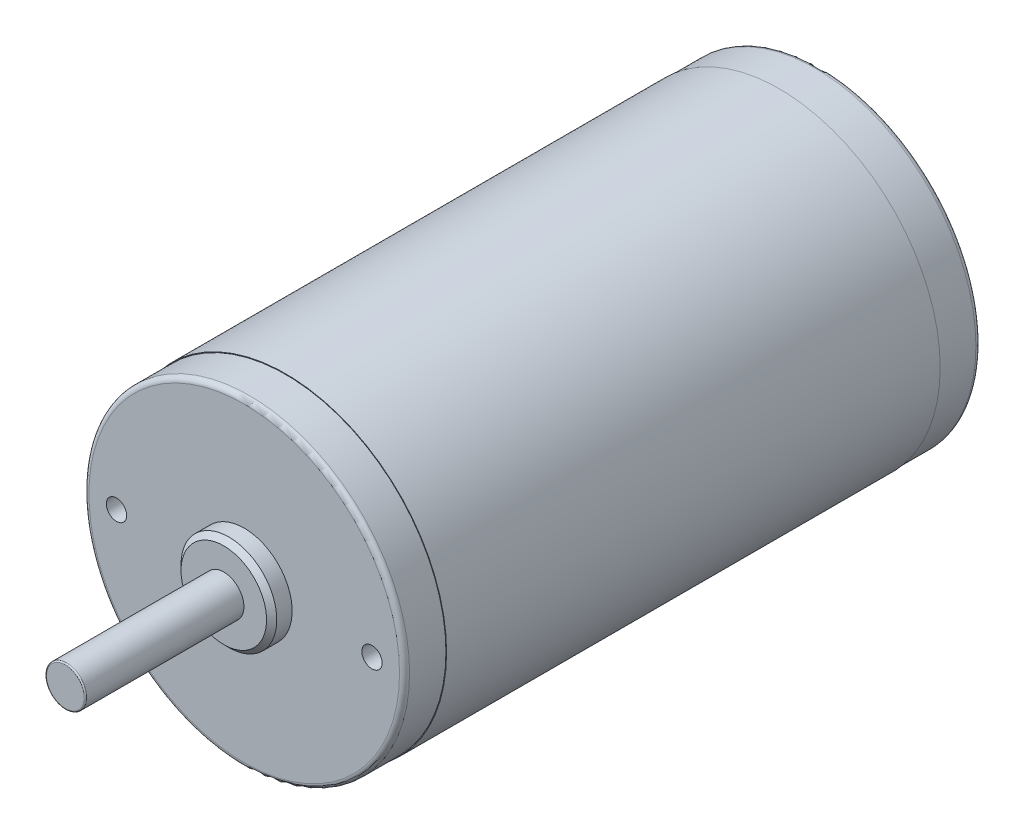
from build123d import *

# Parameters (mm, degrees)
SKETCH1_W           = 32.004
SKETCH1_H           = 98.1456
SKETCH2_R           = 31.877
BOSS_EXTRUDE1_DEPTH = 8.2296
SKETCH5_R           = 9.525
BOSS_EXTRUDE2_DEPTH = 4.572
SKETCH6_R           = 4
BOSS_EXTRUDE3_DEPTH = 31.5
BOSS_EXTRUDE4_START = 8.2296
SKETCH8_R           = 31.877
BOSS_EXTRUDE4_DEPTH = 8.2296
SKETCH9_R           = 15.0368
BOSS_EXTRUDE5_DEPTH = 4.7625
HOLE2_D             = 4.0386
HOLE2_DEPTH         = 13.6144
HOLE2_TIP           = 1.213317848
HOLE3_D             = 4.0386
HOLE3_DEPTH         = 13.6144
HOLE3_TIP           = 1.213317848
CHAMFER1_SIZE       = 1.015999998
CHAMFER1_SIZE2      = 1.016
FILLET1_R           = 0.254
FILLET2_R           = 1
FILLET3_R           = 1
FILLET4_R           = 1


with BuildPart() as part:
    # Sketch1 → Revolve1 (revolve)
    with BuildSketch(Plane.XZ.offset(-109.2962)):
        with Locations((51.562, -38.2524)):
            Rectangle(SKETCH1_W, SKETCH1_H)
    revolve(axis=Axis((35.56, 109.2962, 10.8204), (0, 0, -1)))

    # Sketch2 → Boss-Extrude1 (add)
    with BuildSketch(Plane.XY.offset(10.8204)):
        with Locations((35.56, 109.2962)):
            Circle(SKETCH2_R)
    extrude(amount=BOSS_EXTRUDE1_DEPTH)

    # Sketch5 → Boss-Extrude2 (add)
    with BuildSketch(Plane(origin=(0, 0, 18.542), x_dir=(-1, 0, 0), z_dir=(0, 0, -1))):
        with Locations((-35.56, 109.2962)):
            Circle(SKETCH5_R)
    extrude(amount=-BOSS_EXTRUDE2_DEPTH)

    # Sketch6 → Boss-Extrude3 (add)
    with BuildSketch(Plane.XY.offset(23.114)):
        with Locations((35.56, 109.2962)):
            Circle(SKETCH6_R)
    extrude(amount=BOSS_EXTRUDE3_DEPTH)

    # Sketch8 → Boss-Extrude4 (add)
    with BuildSketch(Plane(origin=(0, 0, -87.3252), x_dir=(-1, 0, 0), z_dir=(0, 0, -1)).offset(BOSS_EXTRUDE4_START)):
        with Locations((-35.56, 109.2962)):
            Circle(SKETCH8_R)
    extrude(amount=-BOSS_EXTRUDE4_DEPTH)

    # Sketch9 → Boss-Extrude5 (add)
    with BuildSketch(Plane(origin=(0, 0, -95.5548), x_dir=(-1, 0, 0), z_dir=(0, 0, -1))):
        with Locations((-35.56, 109.2962)):
            Circle(SKETCH9_R)
    extrude(amount=BOSS_EXTRUDE5_DEPTH)

    # Hole2
    with Locations(Plane.XY.offset(19.05)):
        with Locations((60.96, 109.2962)):
            Hole(HOLE2_D / 2, depth=HOLE2_DEPTH)
            with Locations((0, 0, -(HOLE2_DEPTH + HOLE2_TIP / 2))):  # 118° drill point
                Cone(0, HOLE2_D / 2, HOLE2_TIP, mode=Mode.SUBTRACT)

    # Hole3
    with Locations(Plane.XY.offset(19.05)):
        with Locations((10.16, 109.2962)):
            Hole(HOLE3_D / 2, depth=HOLE3_DEPTH)
            with Locations((0, 0, -(HOLE3_DEPTH + HOLE3_TIP / 2))):  # 118° drill point
                Cone(0, HOLE3_D / 2, HOLE3_TIP, mode=Mode.SUBTRACT)

    # Chamfer1
    chamfer1_edges = [part.edges().sort_by_distance(p)[0] for p in [
        (45.085, 109.2962, 23.114),
    ]]
    chamfer1_side = [part.faces().sort_by_distance(p)[0] for p in [
        (44.815592316, 109.2962, 23.114),
    ]]
    chamfer(chamfer1_edges, length=CHAMFER1_SIZE, length2=CHAMFER1_SIZE2, reference=chamfer1_side[0])

    # Fillet1
    fillet1_edges = [part.edges().sort_by_distance(p)[0] for p in [
        (31.56, 109.2962, 54.614),
    ]]
    fillet(fillet1_edges, radius=FILLET1_R)

    # Fillet2
    fillet2_edges = [part.edges().sort_by_distance(p)[0] for p in [
        (67.437, 109.2962, -95.5548),
    ]]
    fillet(fillet2_edges, radius=FILLET2_R)

    # Fillet3
    fillet3_edges = [part.edges().sort_by_distance(p)[0] for p in [
        (3.683, 109.2962, 19.05),
    ]]
    fillet(fillet3_edges, radius=FILLET3_R)

    # Fillet4
    fillet4_edges = [part.edges().sort_by_distance(p)[0] for p in [
        (50.5968, 109.2962, -100.3173),
    ]]
    fillet(fillet4_edges, radius=FILLET4_R)


solid = part.part
